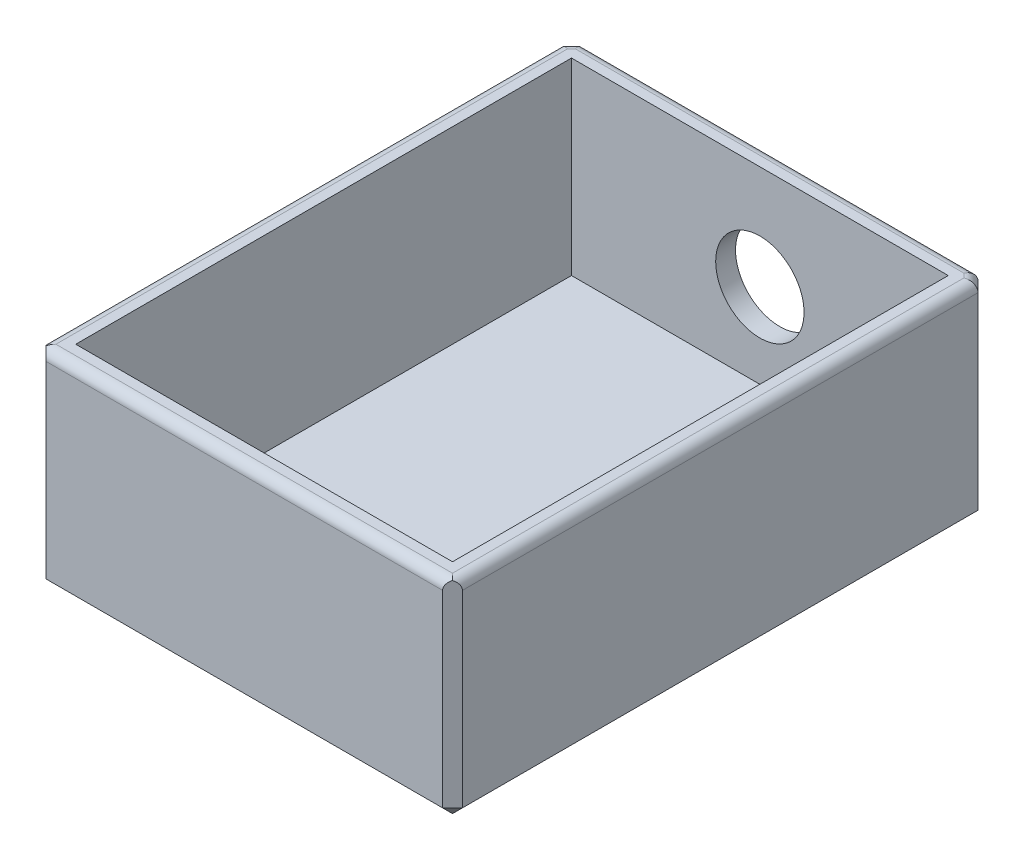
from build123d import *

# Parameters (mm, degrees)
BOSS_EXTRUDE1_DEPTH = 50
SKETCH1_3_W         = 42
SKETCH1_3_H         = 21
BOSS_EXTRUDE2_DEPTH = 2
BOSS_EXTRUDE3_START = 50
SKETCH1_4_W         = 42
SKETCH1_4_H         = 21
BOSS_EXTRUDE3_DEPTH = 2
SKETCH2_R           = 4.458076667
CUT_EXTRUDE1_DEPTH  = 2
CHAMFER1_SIZE       = 1
FILLET1_R           = 1


with BuildPart() as part:
    # Sketch1 → Boss-Extrude1 (new body)
    with BuildSketch(Plane.XY):
        Polygon((40, 21), (40, 2), (2, 2), (2, 21), (0, 21), (0, 0), (42, 0), (42, 21), align=None)
    extrude(amount=BOSS_EXTRUDE1_DEPTH)

    # Sketch1<3> → Boss-Extrude2 (add)
    with BuildSketch(Plane.XY):
        with Locations((21, 10.5)):
            Rectangle(SKETCH1_3_W, SKETCH1_3_H)
    extrude(amount=-BOSS_EXTRUDE2_DEPTH)

    # Sketch1<4> → Boss-Extrude3 (add)
    with BuildSketch(Plane.XY.offset(BOSS_EXTRUDE3_START)):
        with Locations((21, 10.5)):
            Rectangle(SKETCH1_4_W, SKETCH1_4_H)
    extrude(amount=BOSS_EXTRUDE3_DEPTH)

    # Sketch2 → Cut-Extrude1 (cut)
    with BuildSketch(Plane(origin=(0, 0, -2), x_dir=(-1, 0, 0), z_dir=(0, 0, -1))):
        with Locations((-21, 10.5)):
            Circle(SKETCH2_R)
    extrude(amount=-CUT_EXTRUDE1_DEPTH, mode=Mode.SUBTRACT)

    # Chamfer1
    chamfer1_edges = [part.edges().sort_by_distance(p)[0] for p in [
        (42, 0, 25),
        (0, 0, 25),
        (42, 10.5, -2),
        (21, 0, -2),
        (0, 10.5, -2),
        (42, 10.5, 52),
        (21, 0, 52),
        (0, 10.5, 52),
    ]]
    chamfer(chamfer1_edges, length=CHAMFER1_SIZE)

    # Fillet1
    # the kernel refuses this fillet: 1 mm, written as the material it takes off along each edge
    with BuildSketch(Plane(origin=(43.5, 21, 52), x_dir=(0, 0, -1), z_dir=(-1, 0, 0))) as fillet1_piece_1:
        with BuildLine():
            CenterArc((FILLET1_R, FILLET1_R), FILLET1_R, 180, 90)
            Line((0, FILLET1_R), (0, 0))
            Line((0, 0), (FILLET1_R, 0))
        make_face()
    extrude(amount=45, mode=Mode.SUBTRACT)
    with BuildSketch(Plane(origin=(0, 21, -3.5), x_dir=(1, 0, 0), z_dir=(0, 0, 1)), Plane(origin=(42, 21, 53.5), x_dir=(-1, 0, 0), z_dir=(0, 0, -1))) as fillet1_piece_2:
        with BuildLine():
            CenterArc((FILLET1_R, -FILLET1_R), FILLET1_R, 90, 90)
            Line((0, -FILLET1_R), (0, 0))
            Line((0, 0), (FILLET1_R, 0))
        make_face()
    extrude(amount=57, mode=Mode.SUBTRACT)
    with BuildSketch(Plane(origin=(43.5, 21, -2), x_dir=(0, 0, 1), z_dir=(-1, 0, 0))) as fillet1_piece_3:
        with BuildLine():
            CenterArc((FILLET1_R, -FILLET1_R), FILLET1_R, 90, 90)
            Line((0, -FILLET1_R), (0, 0))
            Line((0, 0), (FILLET1_R, 0))
        make_face()
    extrude(amount=45, mode=Mode.SUBTRACT)
    with BuildSketch(Plane(origin=(-1.767766953, 21, 0.767766953), x_dir=(0.7071067811865476, 0, 0.7071067811865476), z_dir=(0.7071067811865476, 0, -0.7071067811865476))) as fillet1_piece_4:
        with BuildLine():
            CenterArc((FILLET1_R, FILLET1_R), FILLET1_R, 180, 90)
            Line((0, FILLET1_R), (0, 0))
            Line((0, 0), (FILLET1_R, 0))
        make_face()
    extrude(amount=6.414213562, mode=Mode.SUBTRACT)
    with BuildSketch(Plane(origin=(43.767766953, 21, 0.767766953), x_dir=(-0.7071067811865475, 0, 0.7071067811865476), z_dir=(-0.7071067811865476, 0, -0.7071067811865476))) as fillet1_piece_5:
        with BuildLine():
            CenterArc((FILLET1_R, -FILLET1_R), FILLET1_R, 90, 90)
            Line((0, -FILLET1_R), (0, 0))
            Line((0, 0), (FILLET1_R, 0))
        make_face()
    extrude(amount=6.414213562, mode=Mode.SUBTRACT)


solid = part.part
